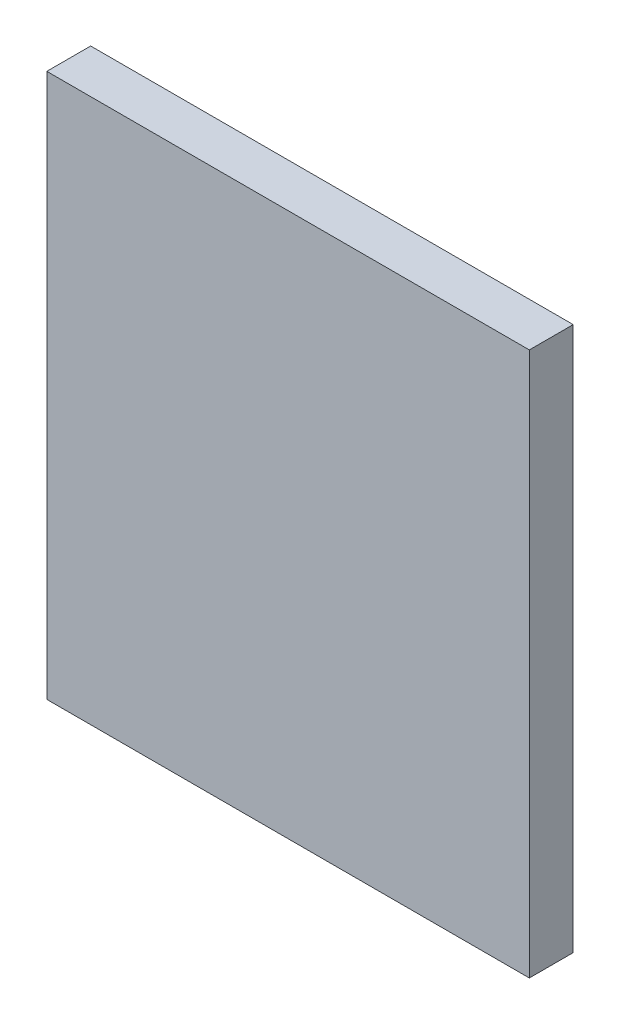
from build123d import *

# Parameters (mm, degrees)
SKETCH_1_W      = 550
SKETCH_1_H      = 620
EXTRUDE_1_DEPTH = 50


with BuildPart() as part:
    # Эскиз1 → Бобышка-Вытянуть1 (new body)
    with BuildSketch(Plane.XY):
        with Locations((275, 310)):
            Rectangle(SKETCH_1_W, SKETCH_1_H)
    extrude(amount=EXTRUDE_1_DEPTH)


solid = part.part
